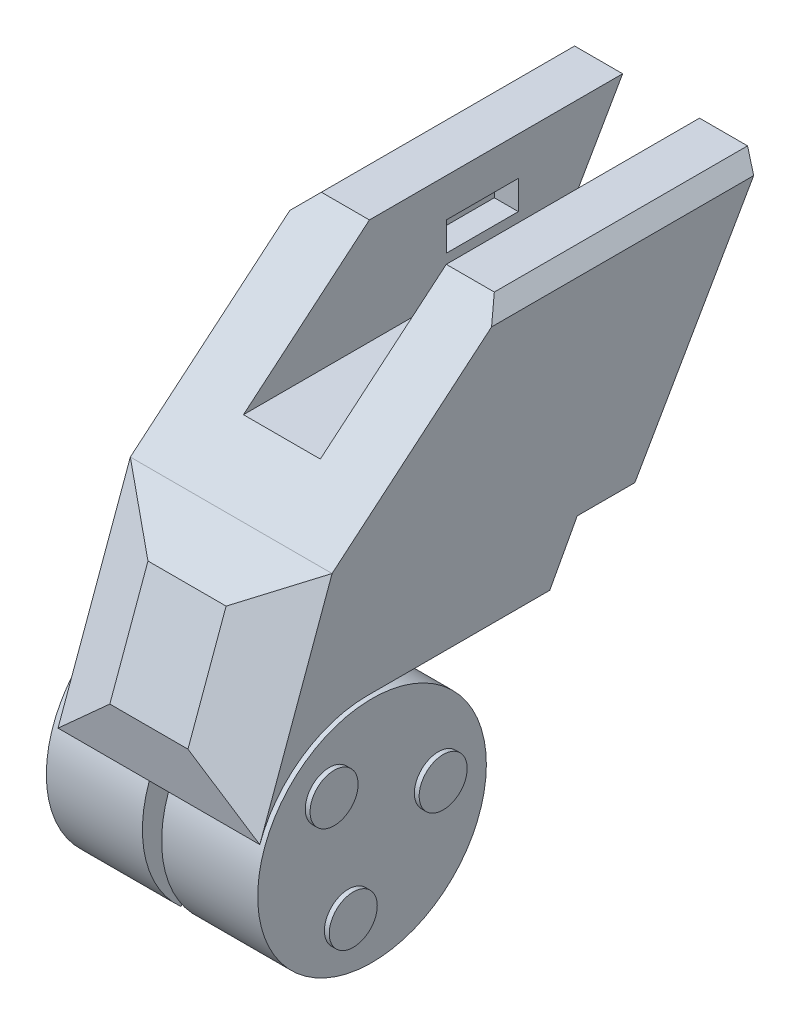
from build123d import *
from OCP.BRepFilletAPI import BRepFilletAPI_MakeChamfer

# Parameters (mm, degrees)
BOSS_EXTRUDE1_START     = 1
SKETCH1_R               = 11.9
BOSS_EXTRUDE1_DEPTH     = 10
BOSS_EXTRUDE3_START     = -1
SKETCH1_3_R             = 11.9
BOSS_EXTRUDE3_DEPTH     = 10
SKETCH3_R               = 6
CUT_EXTRUDE1_DEPTH      = 4
SKETCH4_R               = 6
CUT_EXTRUDE2_DEPTH      = 4
BOSS_EXTRUDE9_DEPTH     = 10.5
BOSS_EXTRUDE10_DEPTH    = 3
CHAMFER4_SIZE           = 3
CHAMFER4_SIZE_2         = 5.196152423
CHAMFER5_SIZE           = 3
CHAMFER5_SIZE2          = 6.433520761528718
SKETCH17_R              = 2.500000000000001
SKETCH17_R_2            = 2.500000000000368
SKETCH17_R_3            = 2.5000000000002682
BOSS_EXTRUDE11_DEPTH    = 0.5
BOSS_EXTRUDE12_START    = 0.5
SKETCH18_R              = 2.5000000000000013
SKETCH18_R_2            = 2.5000000000003686
SKETCH18_R_3            = 2.500000000000268
BOSS_EXTRUDE12_DEPTH    = 0.5
CUT_EXTRUDE4_DEPTH      = 59.59880616896635
CHAMFER6_SIZE           = 1.5
SCALE1_SCALE            = 2
SKETCH20_W              = 15
SKETCH20_H              = 6
CUT_EXTRUDE5_DEPTH      = 5
CUT_EXTRUDE8_DEPTH      = 12
CUT_EXTRUDE8_DEPTH_BACK = 8


with BuildPart() as part:
    # Sketch1 → Boss-Extrude1 (new body)
    with BuildSketch(Plane(origin=(0, 0, 0), x_dir=(0, 0, -1), z_dir=(1, 0, 0)).offset(BOSS_EXTRUDE1_START)):
        Circle(SKETCH1_R)
    extrude(amount=BOSS_EXTRUDE1_DEPTH)

    # Sketch4 → Cut-Extrude2 (cut)
    with BuildSketch(Plane.ZY.offset(-1)):
        with Locations(Location((0, 0, 0), (0, 0, 180))):
            Circle(SKETCH4_R)
    extrude(amount=-CUT_EXTRUDE2_DEPTH, mode=Mode.SUBTRACT)



with BuildPart() as body_2:
    # Sketch1<3> → Boss-Extrude3 (new body)
    with BuildSketch(Plane(origin=(0, 0, 0), x_dir=(0, 0, -1), z_dir=(1, 0, 0)).offset(BOSS_EXTRUDE3_START)):
        Circle(SKETCH1_3_R)
    extrude(amount=-BOSS_EXTRUDE3_DEPTH)

    # Sketch3 → Cut-Extrude1 (cut)
    with BuildSketch(Plane(origin=(-1, 0, 0), x_dir=(0, 0, -1), z_dir=(1, 0, 0))):
        Circle(SKETCH3_R)
    extrude(amount=-CUT_EXTRUDE1_DEPTH, mode=Mode.SUBTRACT)


with BuildPart() as part_1:
    add(part.part)

    add(body_2.part)  # Boss-Extrude9 merges body 2
    # Sketch15 → Boss-Extrude9 (add, symmetric)
    with BuildSketch(Plane(origin=(0, 0, 0), x_dir=(0, 0, -1), z_dir=(1, 0, 0))):
        with BuildLine():
            Line((0, 11.9), (19, 11.9))
            Line((19, 11.9), (21.856908233869017, 17.17617999534241))
            Line((21.856908233869017, 17.17617999534241), (27.856908233869014, 17.176179995342412))
            Line((27.856908233869014, 17.176179995342412), (41.084385398468356, 40.17017999534242))
            Line((41.084385398468356, 40.17017999534242), (14.727167600667759, 40.170179995342416))
            Line((14.727167600667759, 40.170179995342416), (-3.657899034187683, 24.74327736286543))
            Line((-3.657899034187683, 24.74327736286543), (-11.182342187352324, 4.070039705575419))
            ThreePointArc((-11.182342187352324, 4.070039705575419), (-6.825559592577466, 9.74790932703899), (0, 11.9))
        make_face()
    extrude(amount=BOSS_EXTRUDE9_DEPTH, both=True)

    # Sketch16 → Boss-Extrude10 (add)
    with BuildSketch(Plane(origin=(0, 4.0700397055754225, 11.182342187352331), x_dir=(1, 0, 0), z_dir=(0, 0.34202014332566566, 0.9396926207859096))):
        Polygon((-10.5, 22.000000000000004), (-10.5, -1.3e-15), (-1, 0), (1, 0), (10.5, -1.3e-15), (10.5, 22.000000000000004), align=None)
    extrude(amount=BOSS_EXTRUDE10_DEPTH)

    # Chamfer4
    chamfer4_edges_1 = [part_1.edges().sort_by_distance(p)[0] for p in [
        (0, 5.096100135552418, 14.00142004971006),
    ]]
    chamfer4_side_1 = [part_1.faces().sort_by_distance(p)[0] for p in [
        (0, 5.075578926952878, 13.945038492462905),
    ]]
    chamfer4_edges_2 = [part_1.edges().sort_by_distance(p)[0] for p in [
        (0, 25.769337792842435, 6.4769768965454135),
    ]]
    chamfer4_side_2 = [part_1.faces().sort_by_distance(p)[0] for p in [
        (0, 25.712956235595282, 6.497498105144953),
    ]]
    chamfer4 = BRepFilletAPI_MakeChamfer(part_1.part.solid().wrapped)
    for e in chamfer4_edges_1:
        chamfer4.Add(CHAMFER4_SIZE - 0.0001, CHAMFER4_SIZE_2 - 0.0001, e.wrapped, chamfer4_side_1[0].wrapped)
    for e in chamfer4_edges_2:
        chamfer4.Add(CHAMFER4_SIZE_2 - 0.0001, CHAMFER4_SIZE - 0.0001, e.wrapped, chamfer4_side_2[0].wrapped)
    add(Compound.cast(chamfer4.Shape()), mode=Mode.REPLACE)  # a hair under: the kernel refuses the full size

    # Chamfer5: one chamfer whose edges measure the first distance from different faces: ONE call of the kernel's chamfer builder (chamfer() names one face for all edges)
    chamfer5_edges_1 = [part_1.edges().sort_by_distance(p)[0] for p in [
        (-10.5, 15.432718964197425, 10.239198473127738),
    ]]
    chamfer5_side_1 = [part_1.faces().sort_by_distance(p)[0] for p in [
        (-10.5, 25.100235238560476, -14.351576366544348),
    ]]
    chamfer5_edges_2 = [part_1.edges().sort_by_distance(p)[0] for p in [
        (10.5, 15.432718964197427, 10.239198473127736),
    ]]
    chamfer5_side_2 = [part_1.faces().sort_by_distance(p)[0] for p in [
        (10.5, 25.100235238560483, -14.35157636654435),
    ]]
    chamfer5 = BRepFilletAPI_MakeChamfer(part_1.part.solid().wrapped)
    for e in chamfer5_edges_1:
        chamfer5.Add(CHAMFER5_SIZE, CHAMFER5_SIZE2, e.wrapped, chamfer5_side_1[0].wrapped)  # the first distance lies on this face
    for e in chamfer5_edges_2:
        chamfer5.Add(CHAMFER5_SIZE, CHAMFER5_SIZE2, e.wrapped, chamfer5_side_2[0].wrapped)  # the first distance lies on this face
    add(Compound.cast(chamfer5.Shape()), mode=Mode.REPLACE)

    # Sketch17 → Boss-Extrude11 (add)
    with BuildSketch(Plane(origin=(11, 0, 0), x_dir=(0, 0, -1), z_dir=(1, 0, 0))):
        with Locations((-4.449357706456068, 5.404)):
            Circle(SKETCH17_R)
        with Locations((6.9046801352792615, 1.1512568043153382)):
            Circle(SKETCH17_R_2)
        with Locations((-2.4553224288227398, -6.5552568043149675)):
            Circle(SKETCH17_R_3)
    extrude(amount=BOSS_EXTRUDE11_DEPTH)

    # Sketch18 → Boss-Extrude12 (add)
    with BuildSketch(Plane.ZY.offset(11).offset(BOSS_EXTRUDE12_START)):
        with Locations(Location((4.449357706456068, 5.404, 0), (0, 0, 180))):
            Circle(SKETCH18_R)
        with Locations(Location((-6.9046801352792615, 1.1512568043153382, 0), (0, 0, 180))):
            Circle(SKETCH18_R_2)
        with Locations(Location((2.4553224288227398, -6.5552568043149675, 0), (0, 0, 180))):
            Circle(SKETCH18_R_3)
    extrude(amount=-BOSS_EXTRUDE12_DEPTH)

    # Sketch19 → Cut-Extrude4 (cut, through all)
    with BuildSketch(Plane.XY):
        Polygon((-4.000000000000002, 40.170179995342416), (4.000000000000002, 40.170179995342416), (4, 29.170179995342412), (-4, 29.170179995342412), align=None)
    extrude(amount=-CUT_EXTRUDE4_DEPTH, mode=Mode.SUBTRACT)

    # Chamfer6
    chamfer6_edges = [part_1.edges().sort_by_distance(p)[0] for p in [
        (-10.5, 40.17017999534242, -27.905776499568056),
        (10.5, 40.17017999534242, -27.905776499568056),
    ]]
    chamfer(chamfer6_edges, length=CHAMFER6_SIZE)


with BuildPart() as part_2:
    # Scale1: scaled about (0, 0, 0)
    add(part_1.part.scale(SCALE1_SCALE))

    # Sketch20 → Cut-Extrude5 (cut)
    with BuildSketch(Plane(origin=(-7.999999999999991, -1.26e-15, 0), x_dir=(0, 0, -1), z_dir=(1, 1.6e-16, 0))):
        with Locations((52.95433520133552, 69.34035999068483)):
            Rectangle(SKETCH20_W, SKETCH20_H)
    cut_extrude5 = extrude(amount=-CUT_EXTRUDE5_DEPTH, mode=Mode.SUBTRACT)

    # Mirror4: Cut-Extrude5 across plane
    add(cut_extrude5.mirror(Plane(origin=(0, 0, 0), x_dir=(0, 0, 1), z_dir=(1, 0, 0))), mode=Mode.SUBTRACT)

    # Sketch21 → Cut-Extrude8 (cut, two sides: drawn at the far end of the back side and taken through both)
    with BuildSketch(Plane(origin=(-2, 0, 0), x_dir=(0, 0, -1), z_dir=(1, 0, 0)).offset(-CUT_EXTRUDE8_DEPTH_BACK)):
        with BuildLine():
            Line((4.835188897605762, -10.982756863578018), (9.589791313584762, -21.78246777942974))
            ThreePointArc((9.589791313584762, -21.78246777942974), (-3.6733884927618106, -23.514808461504543), (-15.776309939282067, -17.819877796991495))
            Line((-15.776309939282067, -17.819877796991495), (-9.625245425797857, -7.166215911703854))
            ThreePointArc((-9.625245425797857, -7.166215911703854), (-3.062295967922119, -11.60268690454276), (4.835188897605762, -10.982756863578018))
        make_face()
    extrude(amount=CUT_EXTRUDE8_DEPTH + CUT_EXTRUDE8_DEPTH_BACK, mode=Mode.SUBTRACT)


solid = part_2.part
